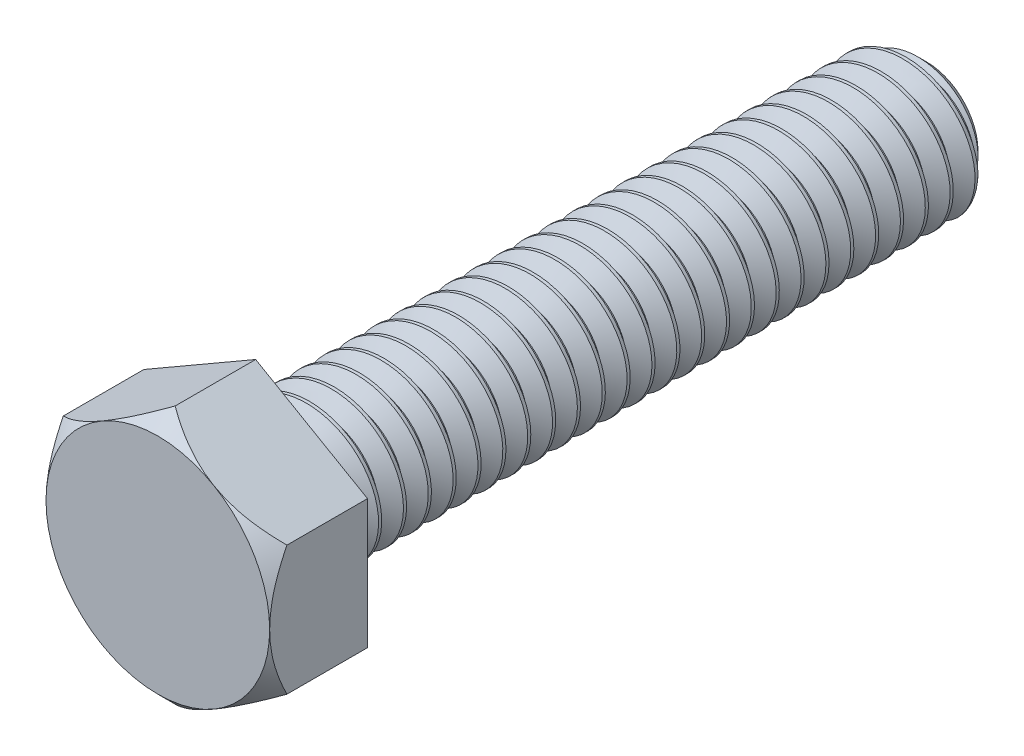
from build123d import *

# Parameters (mm, degrees)
BOSS_EXTRUDE1_DEPTH = 5.55625
SKETCH3_R           = 3.9751
BOSS_EXTRUDE2_DEPTH = 38.1
CHAMFER1_SIZE       = 1.058333333
SKETCH4_OUTSIDE_W   = 115.696
SKETCH4_OUTSIDE_H   = 117.66
SKETCH4_OUTSIDE_R   = 6.35
CUT_EXTRUDE1_DEPTH  = 45.720845222
CUT_EXTRUDE1_DRAFT  = -45
CUT_SWEEP1_PITCH    = 1.411111111


with BuildPart() as part:
    # Sketch2 → Boss-Extrude1 (new body)
    with BuildSketch(Plane.XY):
        Polygon((6.35, 3.666174209), (0, 7.332348419), (-6.35, 3.666174209), (-6.35, -3.666174209), (0, -7.332348419), (6.35, -3.666174209), align=None)
    extrude(amount=-BOSS_EXTRUDE1_DEPTH)

    # Sketch3 → Boss-Extrude2 (add)
    with BuildSketch(Plane(origin=(0, 0, -5.55625), x_dir=(-1, 0, 0), z_dir=(0, 0, -1))):
        with Locations(Location((0, 0, 0), (0, 0, 180))):
            Circle(SKETCH3_R)
    extrude(amount=BOSS_EXTRUDE2_DEPTH)

    # Chamfer1
    chamfer1_edges = [part.edges().sort_by_distance(p)[0] for p in [
        (-3.9751, 0, -43.65625),
    ]]
    chamfer(chamfer1_edges, length=CHAMFER1_SIZE)


with BuildPart() as cut_extrude1_tool:
    # Sketch4 outside → Cut-Extrude1 (with draft: the straight prism first)
    with BuildSketch(Plane.XY):
        Rectangle(SKETCH4_OUTSIDE_W, SKETCH4_OUTSIDE_H)
        Circle(SKETCH4_OUTSIDE_R, mode=Mode.SUBTRACT)
    extrude(amount=-CUT_EXTRUDE1_DEPTH)
    # Cut-Extrude1: the draft: its side faces are tilted about the plane it starts from
    cut_extrude1_sides = [cut_extrude1_tool.faces().sort_by_distance(p)[0] for p in [
        (0, -58.83, -22.860422611),
        (57.848, 0, -22.860422611),
        (0, 58.83, -22.860422611),
        (-57.848, 0, -22.860422611),
        (-6.35, 0, -22.860422611),
    ]]
    draft(cut_extrude1_sides, Plane.XY, CUT_EXTRUDE1_DRAFT)


with BuildPart() as part_1:
    add(part.part)

    # Cut-Extrude1: cut by cut_extrude1_tool
    add(cut_extrude1_tool.part, mode=Mode.SUBTRACT)

    # Cut-Sweep1: the profile of Sketch6 screwed along a right-hand helix of 28 turns, 8 arcs to a turn; built about Z, then put on its axis
    cut_sweep1_z = Axis((0, 0, 0), (0, 0, 1))
    cut_sweep1_corners = [(4.051478629, 0, 0.044097222), (4.051478629, 0, -1.278819444), (3.058556448, 0, -0.705555556), (3.058556448, 0, -0.529166667)]
    with BuildLine(mode=Mode.PRIVATE) as cut_sweep1_profile:
        Line(cut_sweep1_corners[0], cut_sweep1_corners[1])
        Line(cut_sweep1_corners[1], cut_sweep1_corners[2])
        Line(cut_sweep1_corners[2], cut_sweep1_corners[3])
        Line(cut_sweep1_corners[3], cut_sweep1_corners[0])
    cut_sweep1_cap = Face(cut_sweep1_profile.wire())
    cut_sweep1_turn_angles = [0, 22.5, 45, 67.5, 90, 112.5, 135, 157.5, 180, 202.5, 225, 247.5, 270, 292.5, 315, 337.5, 360]
    cut_sweep1_turn_weights = [1, 0.9238795325112867, 1, 0.9238795325112867, 1, 0.9238795325112867, 1, 0.9238795325112867, 1, 0.9238795325112867, 1, 0.9238795325112867, 1, 0.9238795325112867, 1, 0.9238795325112867, 1]
    cut_sweep1_turn_rails = [Edge.make_bspline([Vector(p[0], p[1], 0).rotate(cut_sweep1_z, cut_sweep1_turn_angles[k]) / cut_sweep1_turn_weights[k] + Vector(0, 0, p[2] + CUT_SWEEP1_PITCH * cut_sweep1_turn_angles[k] / 360) for k in range(17)], [0, 0, 0, 1, 1, 2, 2, 3, 3, 4, 4, 5, 5, 6, 6, 7, 7, 8, 8, 8], 2, cut_sweep1_turn_weights) for p in cut_sweep1_corners]
    cut_sweep1_turn_sides = [Face.make_surface_from_curves(cut_sweep1_turn_rails[p[0]], cut_sweep1_turn_rails[p[1]]) for p in [(0, 1), (1, 2), (2, 3), (3, 0)]]
    cut_sweep1 = Plane(origin=(0, 0, -43.65625), x_dir=(0, 1, 0), z_dir=(0, 0, 1)) * Solid(Shell([*[p.moved(Location((0, 0, CUT_SWEEP1_PITCH * i))) for i in range(28) for p in cut_sweep1_turn_sides], cut_sweep1_cap, cut_sweep1_cap.rotate(cut_sweep1_z, 10080).moved(Location((0, 0, CUT_SWEEP1_PITCH * 10080 / 360)))]))
    add(cut_sweep1, mode=Mode.SUBTRACT)


solid = part_1.part
